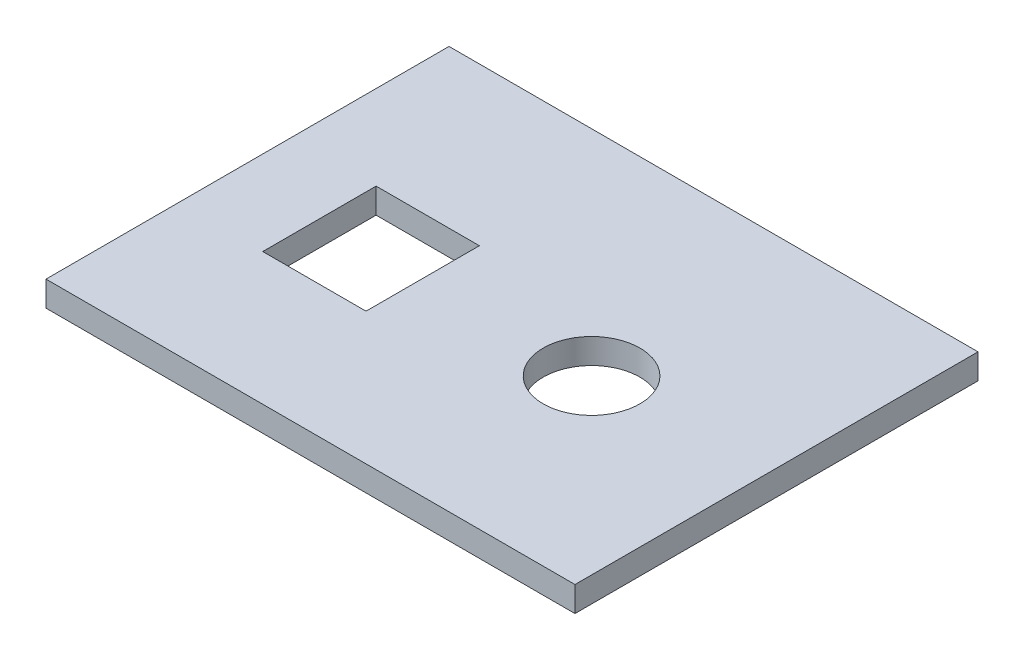
from build123d import *

# Parameters (mm, degrees)
SKETCH2_W               = 210
SKETCH2_H               = 160
BOSS_EXTRUDE1_DEPTH     = 10
CUT_EXTRUDE2_DEPTH      = 15
CUT_EXTRUDE2_DEPTH_BACK = 22
SKETCH3_R               = 19.2
SKETCH3_W               = 41
SKETCH3_H               = 45


with BuildPart() as part:
    # Sketch2 → Boss-Extrude1 (new body)
    with BuildSketch(Plane(origin=(0, 0, 0), x_dir=(1, 0, 0), z_dir=(0, 1, 0))):
        with Locations((5, 5)):
            Rectangle(SKETCH2_W, SKETCH2_H)
    extrude(amount=BOSS_EXTRUDE1_DEPTH)

    # Sketch3 → Cut-Extrude2 (cut, two sides: drawn at the far end of the back side and taken through both)
    with BuildSketch(Plane(origin=(0, 0, 0), x_dir=(1, 0, 0), z_dir=(0, 1, 0)).offset(-CUT_EXTRUDE2_DEPTH_BACK)):
        with Locations((41.585, 0)):
            Circle(SKETCH3_R)
        with Locations((-45.952707493, 0)):
            Rectangle(SKETCH3_W, SKETCH3_H)
    extrude(amount=CUT_EXTRUDE2_DEPTH + CUT_EXTRUDE2_DEPTH_BACK, mode=Mode.SUBTRACT)


solid = part.part
